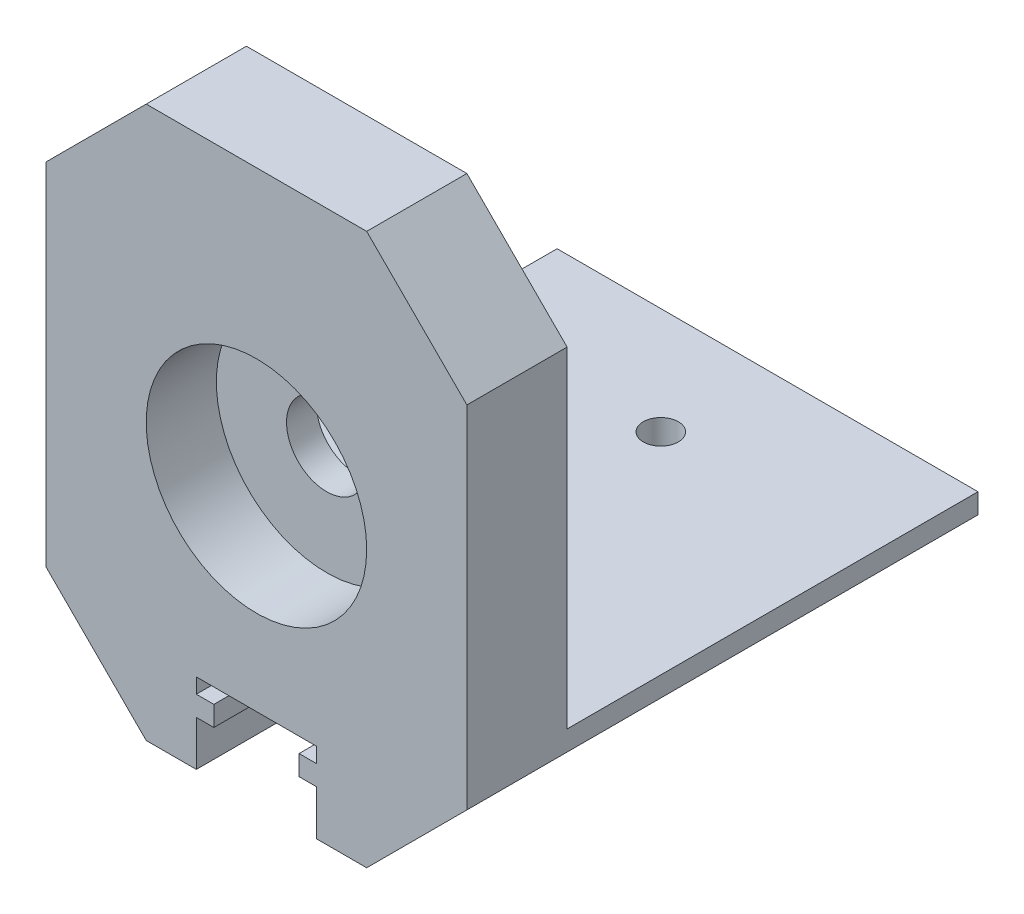
from build123d import *

# Parameters (mm, degrees)
ESTRUSIONE_ESTRUSIONE1_DEPTH = 10
SCHIZZO2_R                   = 11
TAGLIO_ESTRUSIONE1_DEPTH     = 7
SCHIZZO3_R                   = 4
TAGLIO_ESTRUSIONE2_DEPTH     = 36.302266216
ESTRUSIONE_ESTRUSIONE2_DEPTH = 41
SMUSSO1_SIZE                 = 10
SCHIZZO5_R                   = 1.75
TAGLIO_ESTRUSIONE3_DEPTH     = 64.015871017


with BuildPart() as part:
    # Schizzo1 → Estrusione-Estrusione1 (new body)
    with BuildSketch(Plane.XY):
        Polygon((6, -23), (6, -27.5), (21, -27.5), (21, 27.5), (-21, 27.5), (-21, -27.5), (-6, -27.5), (-6, -23), (-4.25, -23), (-4.25, -21), (-6, -21), (-6, -19.5), (6, -19.5), (6, -21), (4.25, -21), (4.25, -23), align=None)
    extrude(amount=ESTRUSIONE_ESTRUSIONE1_DEPTH)

    # Schizzo2 → Taglio-Estrusione1 (cut)
    with BuildSketch(Plane.XY.offset(10)):
        Circle(SCHIZZO2_R)
    extrude(amount=-TAGLIO_ESTRUSIONE1_DEPTH, mode=Mode.SUBTRACT)

    # Schizzo3 → Taglio-Estrusione2 (cut, through all)
    with BuildSketch(Plane.XY.offset(3)):
        Circle(SCHIZZO3_R)
    extrude(amount=-TAGLIO_ESTRUSIONE2_DEPTH, mode=Mode.SUBTRACT)

    # Schizzo4 → Estrusione-Estrusione2 (add)
    with BuildSketch(Plane(origin=(0, 0, 0), x_dir=(-1, 0, 0), z_dir=(0, 0, -1))):
        Polygon((-21, -27.5), (-6, -27.5), (-6, -23), (-4.25, -23), (-4.25, -21), (-6, -21), (-6, -19.5), (6, -19.5), (6, -21), (4.25, -21), (4.25, -23), (6, -23), (6, -27.5), (21, -27.5), (21, -15.5), (-21, -15.5), align=None)
    extrude(amount=ESTRUSIONE_ESTRUSIONE2_DEPTH)

    # Smusso1
    smusso1_edges = [part.edges().sort_by_distance(p)[0] for p in [
        (-21, 27.5, 5),
        (21, 27.5, 5),
        (-21, -27.5, -15.5),
        (21, -27.5, -15.5),
    ]]
    chamfer(smusso1_edges, length=SMUSSO1_SIZE)

    # Schizzo5 → Taglio-Estrusione3 (cut, through all)
    with BuildSketch(Plane(origin=(0, -15.5, 0), x_dir=(1, 0, 0), z_dir=(0, 1, 0))):
        with Locations((0, 30.35)):
            Circle(SCHIZZO5_R)
        with Locations((0, 5.35)):
            Circle(SCHIZZO5_R)
    extrude(amount=-TAGLIO_ESTRUSIONE3_DEPTH, mode=Mode.SUBTRACT)


solid = part.part
